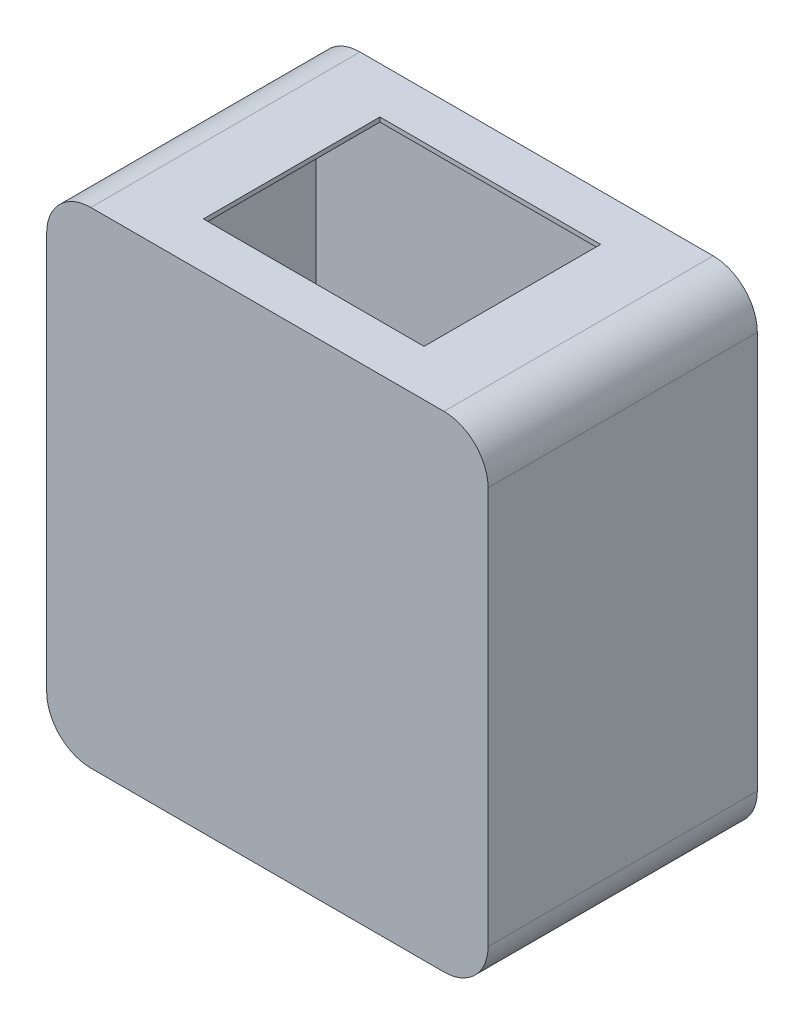
from build123d import *

# Parameters (mm, degrees)
BOSS_EXTRUDE1_DEPTH = 120
BOSS_EXTRUDE2_START = 2
BOSS_EXTRUDE2_DEPTH = 2
SKETCH4_R           = 3.175
CUT_EXTRUDE2_DEPTH  = 2
SKETCH5_W           = 100
SKETCH5_H           = 80
CUT_EXTRUDE3_DEPTH  = 2


with BuildPart() as part:
    # Sketch1 → Boss-Extrude1 (new body)
    with BuildSketch(Plane.XY):
        with BuildLine():
            Line((-98.615233931, 126.753710538), (61.384766069, 126.753710538))
            ThreePointArc((61.384766069, 126.753710538), (75.526901693, 120.895846162), (81.384766069, 106.753710538))
            Line((81.384766069, 106.753710538), (81.384766069, -73.246289462))
            ThreePointArc((81.384766069, -73.246289462), (75.526901693, -87.388425086), (61.384766069, -93.246289462))
            Line((61.384766069, -93.246289462), (-98.615233931, -93.246289462))
            ThreePointArc((-98.615233931, -93.246289462), (-112.757369555, -87.388425086), (-118.615233931, -73.246289462))
            Line((-118.615233931, -73.246289462), (-118.615233931, 106.753710538))
            ThreePointArc((-118.615233931, 106.753710538), (-112.757369555, 120.895846162), (-98.615233931, 126.753710538))
        make_face()
        with BuildLine():
            Line((-96.615233931, 124.753710538), (63.384766069, 124.753710538))
            ThreePointArc((63.384766069, 124.753710538), (73.817087779, 119.312661776), (79.384766069, 108.947368421))
            Line((79.384766069, 108.947368421), (79.384766069, -71.052631579))
            ThreePointArc((79.384766069, -71.052631579), (78.377585569, -77.942212595), (75.069516555, -84.068991401))
            Line((75.069516555, -84.068991401), (-16.615233931, -91.246289462))
            Line((-16.615233931, -91.246289462), (-110.826280736, -85.32012324))
            ThreePointArc((-110.826280736, -85.32012324), (-115.148769435, -78.765785158), (-116.615233931, -71.052631579))
            Line((-116.615233931, -71.052631579), (-116.615233931, 104.753710538))
            ThreePointArc((-116.615233931, 104.753710538), (-110.757369555, 118.895846162), (-96.615233931, 124.753710538))
        make_face(mode=Mode.SUBTRACT)
    extrude(amount=BOSS_EXTRUDE1_DEPTH)

    # Sketch2 → Boss-Extrude2 (add)
    with BuildSketch(Plane(origin=(0, 0, 0), x_dir=(-1, 0, 0), z_dir=(0, 0, -1)).offset(BOSS_EXTRUDE2_START)):
        with BuildLine():
            Line((-81.384766069, -73.246289462), (-81.384766069, 106.753710538))
            ThreePointArc((-81.384766069, 106.753710538), (-75.526901693, 120.895846162), (-61.384766069, 126.753710538))
            Line((-61.384766069, 126.753710538), (98.615233931, 126.753710538))
            ThreePointArc((98.615233931, 126.753710538), (112.757369555, 120.895846162), (118.615233931, 106.753710538))
            Line((118.615233931, 106.753710538), (118.615233931, -73.246289462))
            ThreePointArc((118.615233931, -73.246289462), (112.757369555, -87.388425086), (98.615233931, -93.246289462))
            Line((98.615233931, -93.246289462), (-61.384766069, -93.246289462))
            ThreePointArc((-61.384766069, -93.246289462), (-75.526901693, -87.388425086), (-81.384766069, -73.246289462))
        make_face()
    boss_extrude2 = extrude(amount=-BOSS_EXTRUDE2_DEPTH)

    # Mirror1: Boss-Extrude2 across plane
    add(boss_extrude2.mirror(Plane.XY.offset(59)))

    # Sketch4 → Cut-Extrude2 (cut)
    with BuildSketch(Plane(origin=(0, 0, -2), x_dir=(-1, 0, 0), z_dir=(0, 0, -1))):
        with Locations((18.615233931, -88.071289462)):
            Circle(SKETCH4_R)
    extrude(amount=-CUT_EXTRUDE2_DEPTH, mode=Mode.SUBTRACT)

    # Sketch5 → Cut-Extrude3 (cut)
    with BuildSketch(Plane(origin=(0, 126.753710538, 0), x_dir=(1, 0, 0), z_dir=(0, 1, 0))):
        with Locations((-18.615233931, -59)):
            Rectangle(SKETCH5_W, SKETCH5_H)
    extrude(amount=-CUT_EXTRUDE3_DEPTH, mode=Mode.SUBTRACT)


solid = part.part
